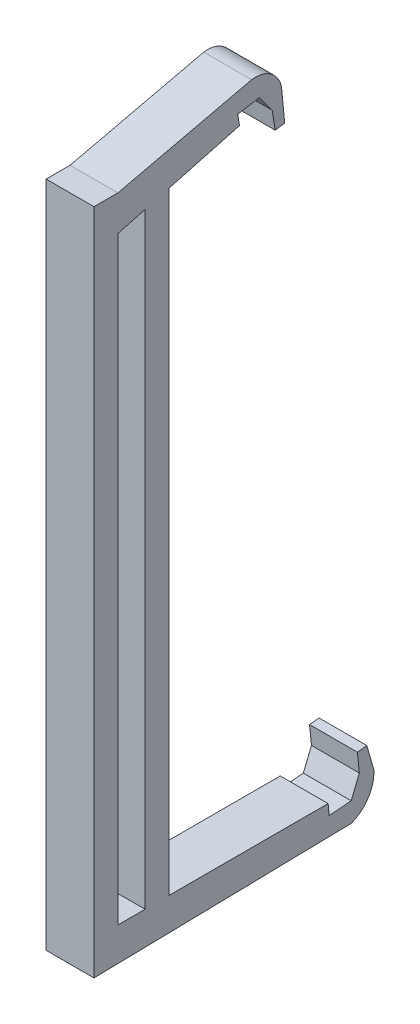
from build123d import *

# Parameters (mm, degrees)
BOSS_EXTRUDE1_DEPTH = 10


# Read off the part's stored shape, not the designer's step: Imported1
with BuildPart() as part:
    # Sketch3 → Boss-Extrude1 (new body)
    with BuildSketch(Plane(origin=(14.999999665, 0, 0), x_dir=(0, 0, -1), z_dir=(1, 0, 0))):
        with BuildLine():
            Line((29.553098604, 349.581092596), (28.873996809, 356.511801481))
            ThreePointArc((28.873996809, 356.511801481), (26.617852211, 359.926750423), (22.636385635, 360.875427723))
            Line((22.636385635, 360.875427723), (-5.304185674, 354.369103909))
            Line((-5.304185674, 354.369103909), (-10.304185562, 354.369103909))
            Line((-10.304185562, 354.369103909), (-10.304185562, 214.764729142))
            Line((-10.304185562, 214.764729142), (43.492022902, 215.872973204))
            ThreePointArc((43.492022902, 215.872973204), (47.063645136, 218.78911025), (48.163164407, 223.266988993))
            Line((48.163164407, 223.266988993), (46.73166573, 228.318288922))
            Line((46.73166573, 228.318288922), (44.741906226, 228.116184473))
            Line((44.741906226, 228.116184473), (45.146130025, 224.136650562))
            Line((45.146130025, 224.136650562), (43.445847929, 219.970226288))
            Line((43.445847929, 219.970226288), (38.855373859, 219.58476305))
            Line((38.855373859, 219.58476305), (38.622945547, 221.872985363))
            Line((38.622945547, 221.872985363), (5.372944754, 221.872985363))
            Line((5.372944754, 221.872985363), (5.372944288, 349.872976542))
            Line((5.372944288, 349.872976542), (20.103313029, 353.819966316))
            Line((20.103313029, 353.819966316), (19.735585898, 356.090396643))
            Line((19.735585898, 356.090396643), (24.27472733, 356.836169958))
            Line((24.27472733, 356.836169958), (26.93930082, 353.209882975))
            Line((26.93930082, 353.209882975), (27.578826994, 349.261313677))
            Line((27.578826994, 349.261313677), (29.553098604, 349.581092596))
        make_face()
        Polygon((-5.304185562, 221.872985363), (0.372943822, 221.872985363), (0.372943822, 348.53323067), (-5.304185562, 347.01204868), align=None, mode=Mode.SUBTRACT)
    extrude(amount=BOSS_EXTRUDE1_DEPTH)


solid = part.part
